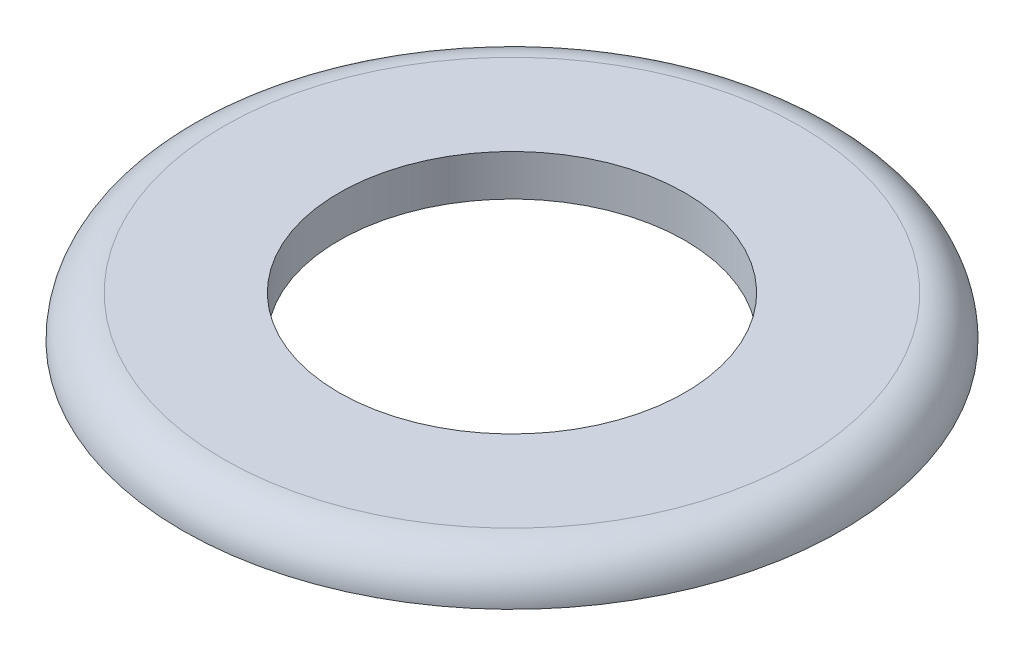
from build123d import *

# Parameters (mm, degrees)
SKETCH1_R           = 4
SKETCH1_R_2         = 2.1
BOSS_EXTRUDE1_DEPTH = 0.5
FILLET2_R           = 0.5


with BuildPart() as part:
    # Sketch1 → Boss-Extrude1 (new body)
    with BuildSketch(Plane(origin=(0, 0, 0), x_dir=(1, 0, 0), z_dir=(0, 1, 0))):
        with Locations(Location((0, 0, 0), (0, 0, 270))):
            Circle(SKETCH1_R)
        with Locations(Location((0, 0, 0), (0, 0, 270))):
            Circle(SKETCH1_R_2, mode=Mode.SUBTRACT)
    extrude(amount=BOSS_EXTRUDE1_DEPTH)

    # Fillet2
    fillet2_edges = [part.edges().sort_by_distance(p)[0] for p in [
        (0, 0.5, -4),
    ]]
    fillet(fillet2_edges, radius=FILLET2_R - 0.0001)  # a hair under: the kernel refuses the full size


solid = part.part
